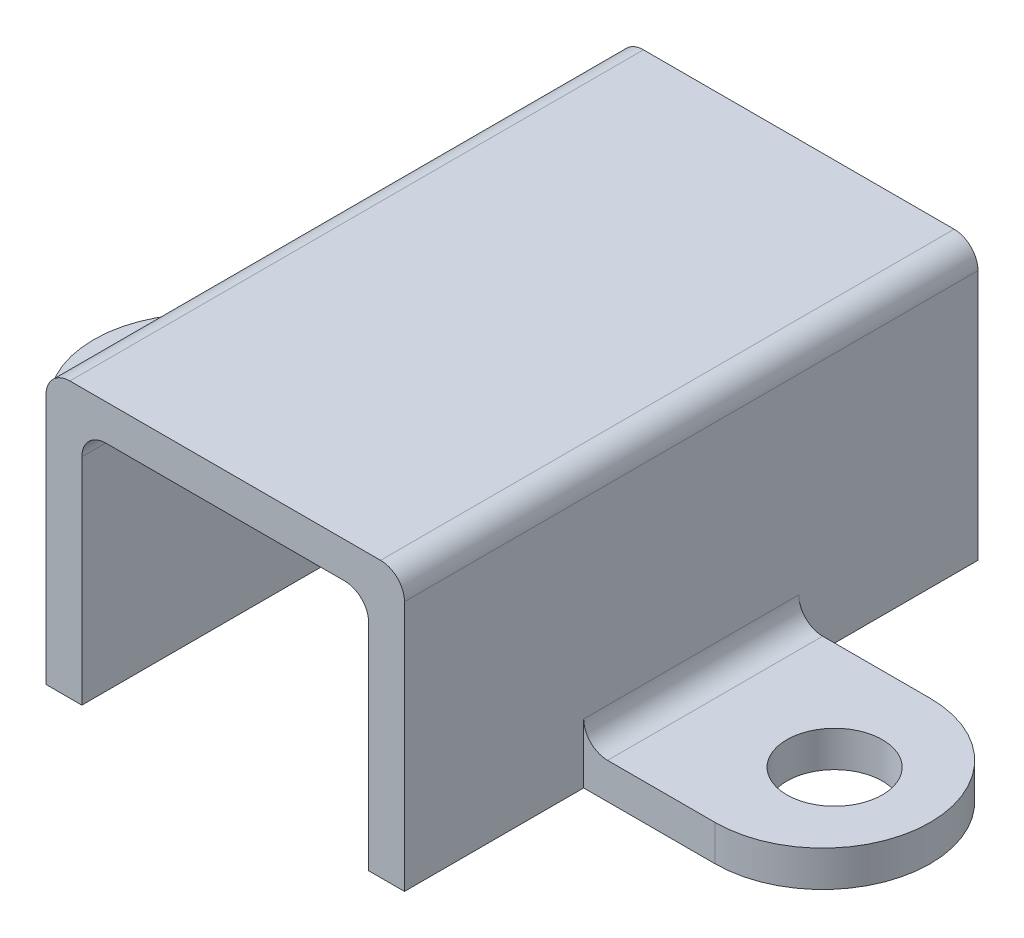
from build123d import *

# Parameters (mm, degrees)
SALIENTE_EXTRUIR2_DEPTH = 12
CROQUIS4_W              = 10
CROQUIS4_H              = 7.5
CORTAR_EXTRUIR2_DEPTH   = 24.457408211
CROQUIS6_R              = 2
CORTAR_EXTRUIR3_DEPTH   = 24.457408211
CORTAR_EXTRUIR4_DEPTH   = 24.457408211
REDONDEO1_R             = 1
REDONDEO2_R             = 1
REDONDEO3_R             = 1
REDONDEO4_R             = 1
REDONDEO5_R             = 1
REDONDEO6_R             = 1


with BuildPart() as part:
    # Croquis1 → Saliente-Extruir2 (new, symmetric)
    with BuildSketch(Plane.XY):
        Polygon((-17.5, -11.5), (-17.5, -10), (-7.5, -10), (-7.5, 0), (7.5, 0), (7.5, -10), (17.5, -10), (17.5, -11.5), (6, -11.5), (6, -1.5), (-6, -1.5), (-6, -11.5), align=None)
    extrude(amount=SALIENTE_EXTRUIR2_DEPTH, both=True)

    # Croquis4 → Cortar-Extruir2 (cut, through all)
    with BuildSketch(Plane(origin=(0, -10, 0), x_dir=(1, 0, 0), z_dir=(0, 1, 0))):
        with Locations((-12.5, 8.25)):
            Rectangle(CROQUIS4_W, CROQUIS4_H)
        with Locations((-12.5, -8.25)):
            Rectangle(CROQUIS4_W, CROQUIS4_H)
        with Locations((12.5, 8.25)):
            Rectangle(CROQUIS4_W, CROQUIS4_H)
        with Locations((12.5, -8.25)):
            Rectangle(CROQUIS4_W, CROQUIS4_H)
    extrude(amount=-CORTAR_EXTRUIR2_DEPTH, mode=Mode.SUBTRACT)

    # Croquis6 → Cortar-Extruir3 (cut, through all)
    with BuildSketch(Plane(origin=(0, -10, 0), x_dir=(1, 0, 0), z_dir=(0, 1, 0))):
        with Locations((-13.5, 0)):
            Circle(CROQUIS6_R)
        with Locations((13.5, 0)):
            Circle(CROQUIS6_R)
    extrude(amount=-CORTAR_EXTRUIR3_DEPTH, mode=Mode.SUBTRACT)

    # Croquis7 → Cortar-Extruir4 (cut, through all)
    with BuildSketch(Plane(origin=(0, -10, 0), x_dir=(1, 0, 0), z_dir=(0, 1, 0))):
        with BuildLine():
            ThreePointArc((-17.5, 0), (-16.181980515, 3.181980515), (-13, 4.5))
            Line((-13, 4.5), (-17.5, 4.5))
            Line((-17.5, 4.5), (-17.5, 0))
        make_face()
        with BuildLine():
            ThreePointArc((-13, -4.5), (-16.181980515, -3.181980515), (-17.5, 0))
            Line((-17.5, 0), (-17.5, -4.5))
            Line((-17.5, -4.5), (-13, -4.5))
        make_face()
        with BuildLine():
            Line((17.5, -4.5), (17.5, 0))
            ThreePointArc((17.5, 0), (16.181980515, -3.181980515), (13, -4.5))
            Line((13, -4.5), (17.5, -4.5))
        make_face()
        with BuildLine():
            Line((17.5, 4.5), (13, 4.5))
            ThreePointArc((13, 4.5), (16.181980515, 3.181980515), (17.5, 0))
            Line((17.5, 0), (17.5, 4.5))
        make_face()
    extrude(amount=-CORTAR_EXTRUIR4_DEPTH, mode=Mode.SUBTRACT)

    # Redondeo1
    redondeo1_edges = [part.edges().sort_by_distance(p)[0] for p in [
        (-7.5, -10, 0),
    ]]
    fillet(redondeo1_edges, radius=REDONDEO1_R)

    # Redondeo2
    redondeo2_edges = [part.edges().sort_by_distance(p)[0] for p in [
        (7.5, -10, 0),
    ]]
    fillet(redondeo2_edges, radius=REDONDEO2_R)

    # Redondeo3
    redondeo3_edges = [part.edges().sort_by_distance(p)[0] for p in [
        (-6, -1.5, 0),
    ]]
    fillet(redondeo3_edges, radius=REDONDEO3_R)

    # Redondeo4
    redondeo4_edges = [part.edges().sort_by_distance(p)[0] for p in [
        (6, -1.5, 0),
    ]]
    fillet(redondeo4_edges, radius=REDONDEO4_R)

    # Redondeo5
    redondeo5_edges = [part.edges().sort_by_distance(p)[0] for p in [
        (-7.5, 0, 0),
    ]]
    fillet(redondeo5_edges, radius=REDONDEO5_R)

    # Redondeo6
    redondeo6_edges = [part.edges().sort_by_distance(p)[0] for p in [
        (7.5, 0, 0),
    ]]
    fillet(redondeo6_edges, radius=REDONDEO6_R)


solid = part.part
